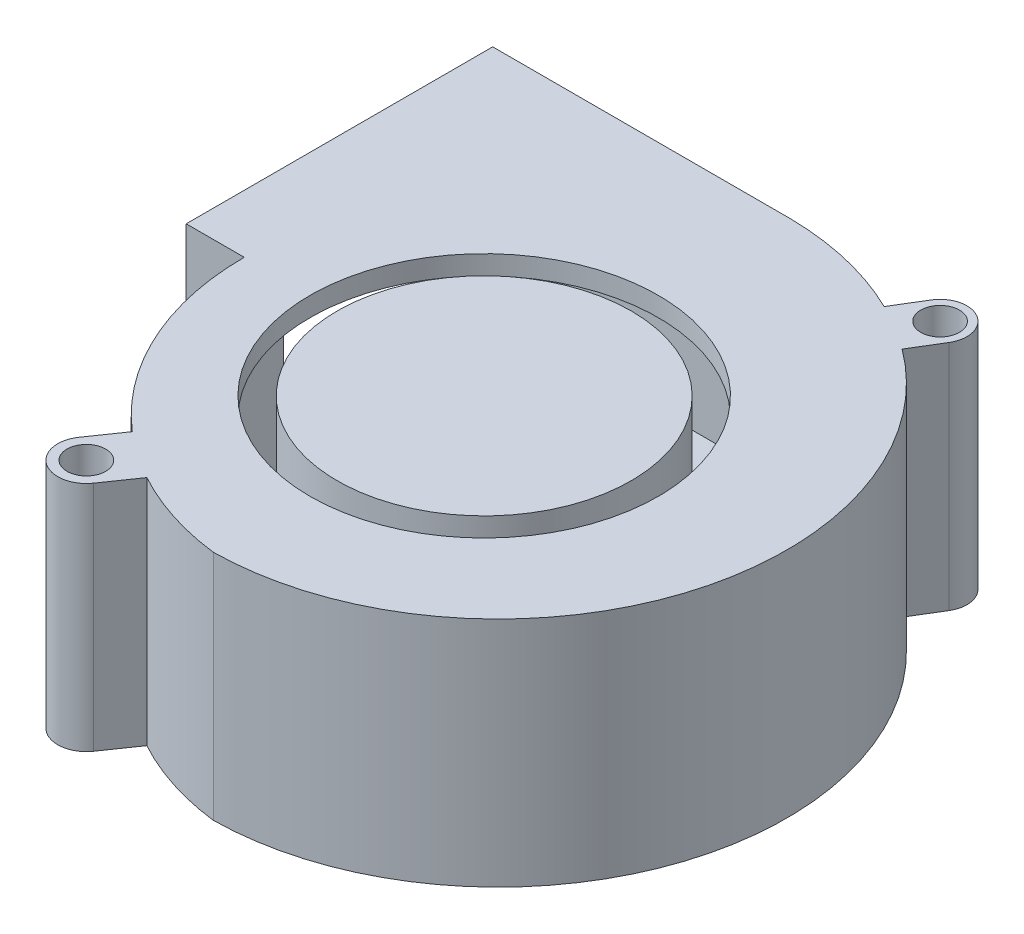
from build123d import *

# Parameters (mm, degrees)
BOSS_EXTRUDE1_DEPTH = 30
SHELL1_START        = 2.5
SHELL1_DEPTH        = 25
SKETCH2_R           = 22.5
CUT_EXTRUDE1_DEPTH  = 14
SKETCH3_R           = 19
BOSS_EXTRUDE2_DEPTH = 27.5
SKETCH4_R           = 2.5
CUT_EXTRUDE2_DEPTH  = 62.932269548


# Read off the part's stored shape, not the designer's step: Shell1
with BuildPart() as part:
    # Sketch1 → Boss-Extrude1 (new body)
    with BuildSketch(Plane(origin=(0, 0, 0), x_dir=(1, 0, 0), z_dir=(0, 1, 0))):
        with BuildLine():
            Line((0.85, 37.3), (-37.65, 37.3))
            Line((-37.65, 37.3), (-37.65, -2.3))
            Line((-37.65, -2.3), (-30.15, -2.3))
            ThreePointArc((-30.15, -2.3), (-26.934732226, -17.009377839), (-17.875408278, -29.035698675))
            Line((-17.875408278, -29.035698675), (-20.686355111, -33.1))
            ThreePointArc((-20.686355111, -33.1), (-19.75, -38.236355111), (-14.613644889, -37.3))
            Line((-14.613644889, -37.3), (-11.802698056, -33.235698675))
            ThreePointArc((-11.802698056, -33.235698675), (-5.669414959, -35.867701083), (0.85, -37.296626142))
            ThreePointArc((0.85, -37.296626142), (35.836650455, -11.487166691), (22.613530114, 29.929532788))
            Line((22.613530114, 29.929532788), (24.907961743, 33.7))
            ThreePointArc((24.907961743, 33.7), (23.75, 38.457961743), (18.992038257, 37.3))
            Line((18.992038257, 37.3), (16.697606627, 33.529532788))
            ThreePointArc((16.697606627, 33.529532788), (8.982141398, 36.290429758), (0.85, 37.3))
        make_face()
    extrude(amount=BOSS_EXTRUDE1_DEPTH)

    # Shell1 outline → Shell1 (cut)
    with BuildSketch(Plane(origin=(0, 0, 0), x_dir=(1, 0, 0), z_dir=(0, 1, 0)).offset(SHELL1_START)):
        with BuildLine():
            Line((-16.669788137, -35.877932863), (-12.534694931, -29.899070296))
            ThreePointArc((-12.534694931, -29.899070296), (-6.046851448, -33.097630874), (0.984836041, -34.794178509))
            ThreePointArc((0.984836041, -34.794178509), (33.813651871, -9.549674864), (19.255072264, 29.219692849))
            Line((19.255072264, 29.219692849), (22.772305532, 34.999604766))
            ThreePointArc((22.772305532, 34.999604766), (22.450395234, 36.322305532), (21.127694468, 36.000395234))
            Line((21.127694468, 36.000395234), (17.610461199, 30.220483316))
            ThreePointArc((17.610461199, 30.220483316), (9.512351913, 33.575155698), (0.832895868, 34.8))
            Line((0.832895868, 34.8), (-37.65, 34.8))
            Line((-37.65, 34.8), (-37.65, 0.2))
            Line((-37.65, 0.2), (-27.554453191, 0.2))
            ThreePointArc((-27.554453191, 0.2), (-24.716370884, -15.848855872), (-14.495118657, -28.543204571))
            Line((-14.495118657, -28.543204571), (-18.630211863, -34.522067137))
            ThreePointArc((-18.630211863, -34.522067137), (-18.327932863, -36.180211863), (-16.669788137, -35.877932863))
        make_face()
    extrude(amount=SHELL1_DEPTH, mode=Mode.SUBTRACT)

    # Sketch2 → Cut-Extrude1 (cut)
    with BuildSketch(Plane(origin=(0, 30, 0), x_dir=(1, 0, 0), z_dir=(0, 1, 0))):
        with Locations(Location((0.85, -2.3, 0), (0, 0, 270))):
            Circle(SKETCH2_R)
    extrude(amount=-CUT_EXTRUDE1_DEPTH, mode=Mode.SUBTRACT)

    # Sketch3 → Boss-Extrude2 (add)
    with BuildSketch(Plane(origin=(0, 2.5, 0), x_dir=(1, 0, 0), z_dir=(0, 1, 0))):
        with Locations(Location((0.85, -2.3, 0), (0, 0, 90))):
            Circle(SKETCH3_R)
    extrude(amount=BOSS_EXTRUDE2_DEPTH)

    # Sketch4 → Cut-Extrude2 (cut, through all)
    with BuildSketch(Plane(origin=(0, 30, 0), x_dir=(1, 0, 0), z_dir=(0, 1, 0))):
        with Locations(Location((21.95, 35.5, 0), (0, 0, 270))):
            Circle(SKETCH4_R)
        with Locations(Location((-17.65, -35.2, 0), (0, 0, 270))):
            Circle(SKETCH4_R)
    extrude(amount=-CUT_EXTRUDE2_DEPTH, mode=Mode.SUBTRACT)


solid = part.part
